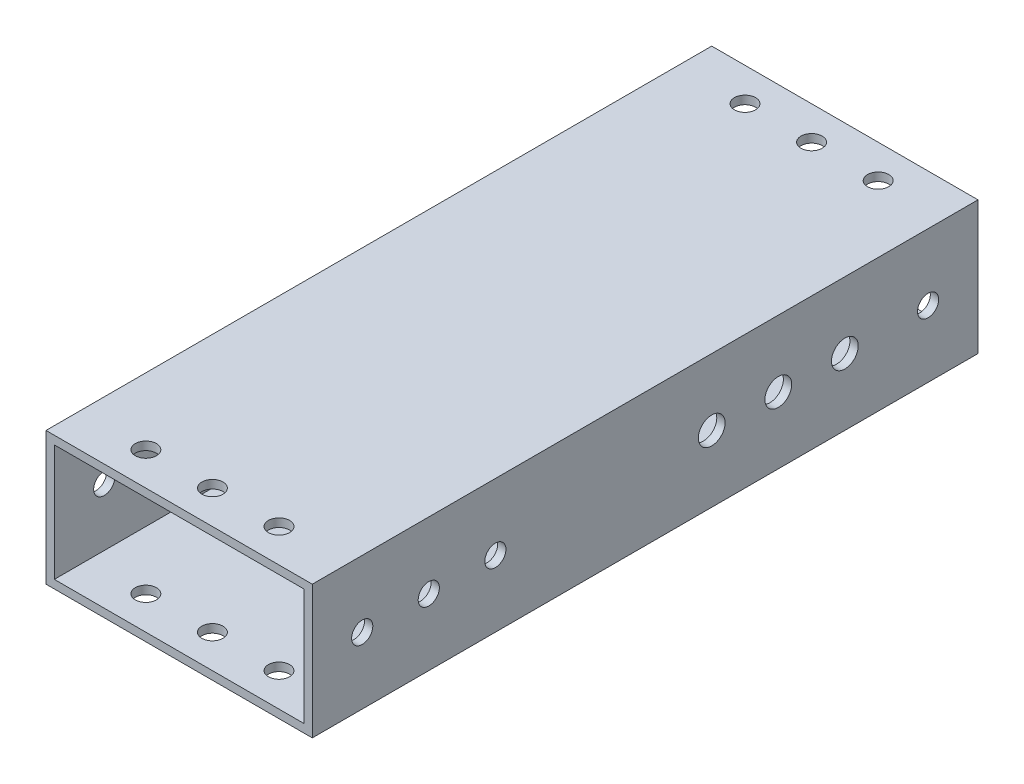
from build123d import *

# Parameters (mm, degrees)
SKETCH1_W           = 50.8
SKETCH1_H           = 25.4
SKETCH1_W_2         = 47.625
SKETCH1_H_2         = 22.225
BOSS_EXTRUDE1_DEPTH = 63.5
SKETCH2_R           = 2.0193
CUT_EXTRUDE1_DEPTH  = 73.955945611
SKETCH3_R           = 2.0193
CUT_EXTRUDE2_DEPTH  = 83.30540687
SKETCH5_R           = 2.5527
CUT_EXTRUDE3_DEPTH  = 83.30540687


with BuildPart() as part:
    # Sketch1 → Boss-Extrude1 (new, symmetric)
    with BuildSketch(Plane.XY):
        Rectangle(SKETCH1_W, SKETCH1_H)
        Rectangle(SKETCH1_W_2, SKETCH1_H_2, mode=Mode.SUBTRACT)
    extrude(amount=BOSS_EXTRUDE1_DEPTH, both=True)

    # Sketch2 → Cut-Extrude1 (cut, through all)
    with BuildSketch(Plane(origin=(0, 12.7, 0), x_dir=(1, 0, 0), z_dir=(0, 1, 0))):
        with Locations((-12.7, 57.15)):
            Circle(SKETCH2_R)
        with Locations((0, 57.15)):
            Circle(SKETCH2_R)
        with Locations((12.7, 57.15)):
            Circle(SKETCH2_R)
        with Locations((12.7, -57.15)):
            Circle(SKETCH2_R)
        with Locations((0, -57.15)):
            Circle(SKETCH2_R)
        with Locations((-12.7, -57.15)):
            Circle(SKETCH2_R)
    extrude(amount=-CUT_EXTRUDE1_DEPTH, mode=Mode.SUBTRACT)

    # Sketch3 → Cut-Extrude2 (cut, through all)
    with BuildSketch(Plane.ZY.offset(25.4)):
        with Locations((-53.975, 0)):
            Circle(SKETCH3_R)
        with Locations((53.975, 0)):
            Circle(SKETCH3_R)
        with Locations((28.575, 0)):
            Circle(SKETCH3_R)
        with Locations((41.275, 0)):
            Circle(SKETCH3_R)
    extrude(amount=-CUT_EXTRUDE2_DEPTH, mode=Mode.SUBTRACT)

    # Sketch5 → Cut-Extrude3 (cut, through all)
    with BuildSketch(Plane(origin=(25.4, 0, 0), x_dir=(0, 0, -1), z_dir=(1, 0, 0))):
        with Locations((25.4, 0)):
            Circle(SKETCH5_R)
        with Locations((38.1, 0)):
            Circle(SKETCH5_R)
        with Locations((12.7, 0)):
            Circle(SKETCH5_R)
    extrude(amount=-CUT_EXTRUDE3_DEPTH, mode=Mode.SUBTRACT)


solid = part.part
